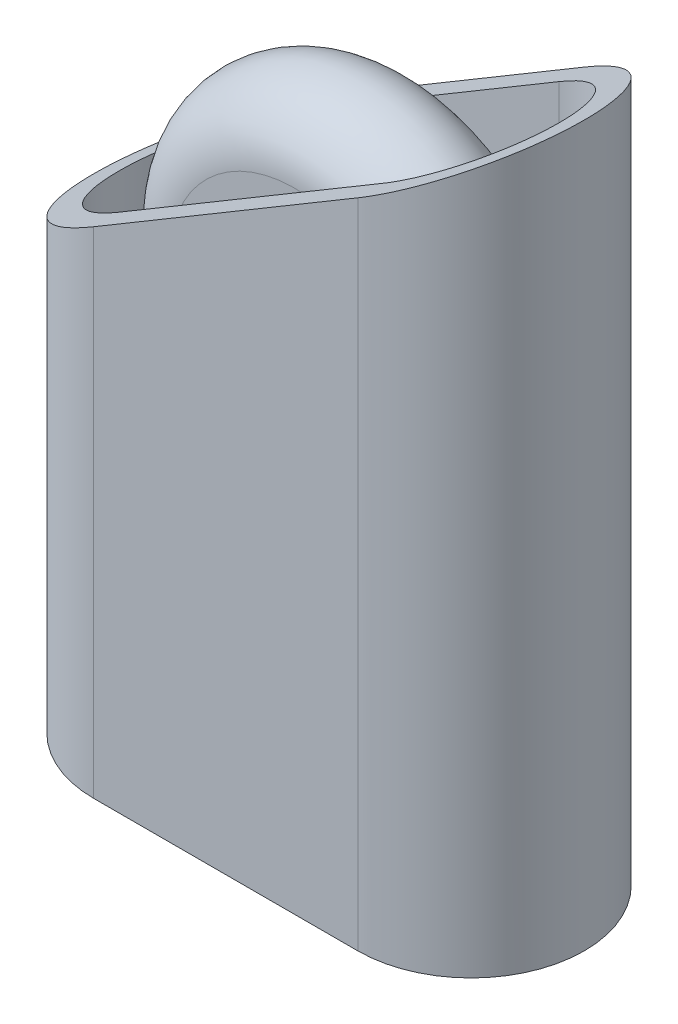
from build123d import *

# Parameters (mm, degrees)
EXTRUDE_1_DEPTH     = 30
CUT_EXTRUDE_1_DEPTH = 5
SKETCH_3_R          = 3.5
EXTRUDE_1_2_DEPTH   = 3.5
SKETCH_4_R          = 7.5
SKETCH_4_R_2        = 3.75
EXTRUDE_2_DEPTH     = 2.5
FILLET_2_R          = 2.5


with BuildPart() as part:
    # 草图1 → Extrude 1 (new body)
    with BuildSketch(Plane(origin=(0, 0, 0), x_dir=(1, 0, 0), z_dir=(0, 1, 0))):
        with BuildLine():
            Line((10.5, -4.5), (0, -4.5))
            ThreePointArc((0, -4.5), (-4.5, 0), (0, 4.5))
            Line((0, 4.5), (10.5, 4.5))
            ThreePointArc((10.5, 4.5), (15, 0), (10.5, -4.5))
        make_face()
        with BuildLine():
            Line((10.5, -3.5), (0, -3.5))
            ThreePointArc((0, -3.5), (-3.5, 0), (0, 3.5))
            Line((0, 3.5), (10.5, 3.5))
            ThreePointArc((10.5, 3.5), (14, 0), (10.5, -3.5))
        make_face(mode=Mode.SUBTRACT)
    extrude(amount=EXTRUDE_1_DEPTH)

    # 草图2 → 切除-拉伸1 (cut, symmetric)
    with BuildSketch(Plane.XY):
        Polygon((-4.5, 17), (15, 28.6), (15, 30), (-4.5, 30), align=None)
    extrude(amount=CUT_EXTRUDE_1_DEPTH, both=True, mode=Mode.SUBTRACT)

    # 草图3 → Extrude 1 2 (add, symmetric)
    with BuildSketch(Plane.XY):
        with Locations((6, 18)):
            Circle(SKETCH_3_R)
    extrude(amount=EXTRUDE_1_2_DEPTH, both=True)


with BuildPart() as body_2:
    # 草图4 → 凸台-拉伸2 (new, symmetric)
    with BuildSketch(Plane.XY):
        with Locations((6, 18)):
            Circle(SKETCH_4_R)
        with Locations((6, 18)):
            Circle(SKETCH_4_R_2, mode=Mode.SUBTRACT)
    extrude(amount=EXTRUDE_2_DEPTH, both=True)

    # 圆角2
    fillet_2_edges = [body_2.edges().sort_by_distance(p)[0] for p in [
        (-1.5, 18, 2.5),
        (-1.5, 18, -2.5),
    ]]
    fillet(fillet_2_edges, radius=FILLET_2_R - 0.0001)  # a hair under: the kernel refuses the full size


solid = Compound([part.part, body_2.part])
